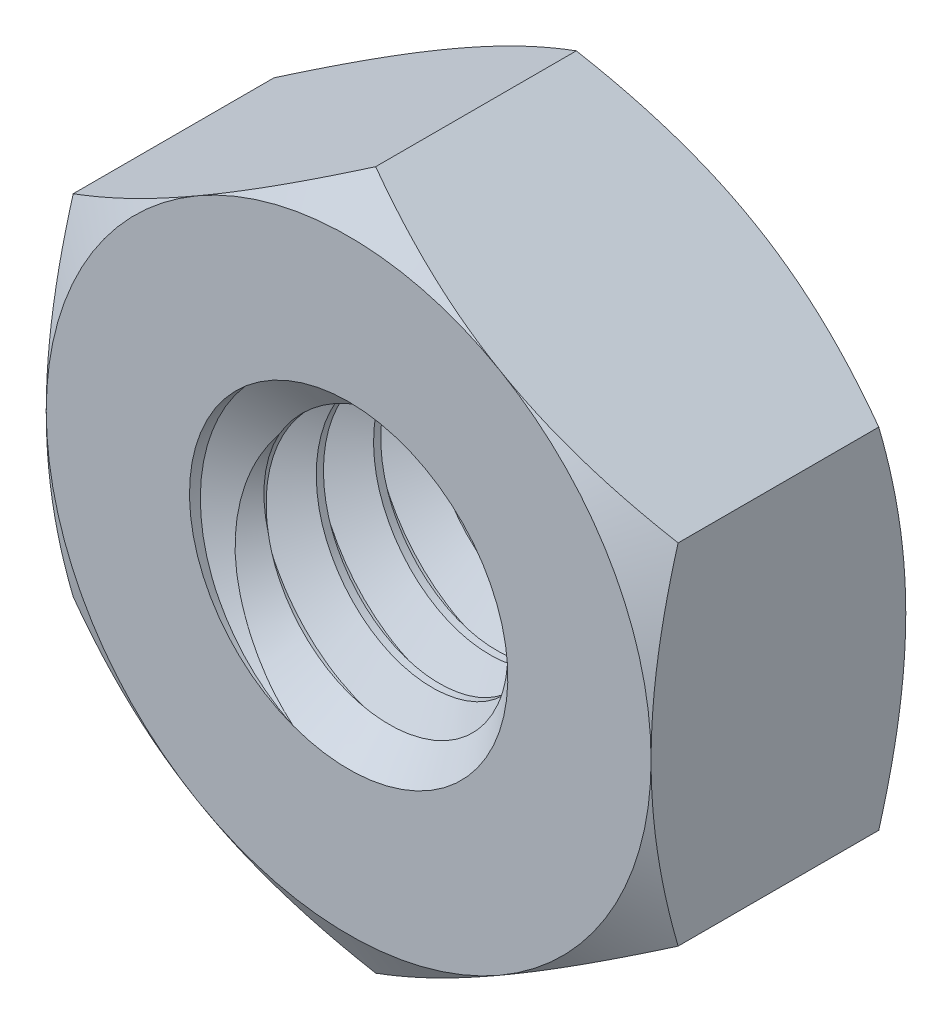
from build123d import *

# Parameters (mm, degrees)
EXTRUDE1_DEPTH          = 1
SKETCH13_R              = 1.25
BOSS_EXTRUDE1_DEPTH     = 2
CUT_SWEEP1_PITCH        = 0.45
SKETCH7_OUTSIDE_W       = 96.244
SKETCH7_OUTSIDE_H       = 96.978
SKETCH7_OUTSIDE_R       = 2.375
EXTRUDE2_DEPTH          = 25.4
EXTRUDE2_DRAFT          = -60
MIRROR2_COPY_1_SKETCH_W = 96.244
MIRROR2_COPY_1_SKETCH_H = 96.978
MIRROR2_COPY_1_SKETCH_R = 2.375
MIRROR2_COPY_1_DEPTH    = 25.4
MIRROR2_COPY_1_DRAFT    = -60


with BuildPart() as part:
    # Sketch1 → Extrude1 (new, symmetric)
    with BuildSketch(Plane.XY):
        Polygon((-2.375, 1.371206889), (-2.375, -1.371206889), (0, -2.742413779), (2.375, -1.371206889), (2.375, 1.371206889), (0, 2.742413779), align=None)
    extrude(amount=EXTRUDE1_DEPTH, both=True)

    # Cut-Extrude2 cone 1 section (through the dimple's axis) → Cut-Extrude2 (revolve, cut)
    with BuildSketch(Plane(origin=(0, 0, 1), x_dir=(0, -1, 0), z_dir=(1, 0, 0))):
        Polygon((0, 0), (1.25, 0), (0, 1.25), align=None)
    revolve(axis=Axis((0, 0, 1), (0, 0, -1)), mode=Mode.SUBTRACT)

    # Cut-Extrude3 cone 1 section (through the dimple's axis) → Cut-Extrude3 (revolve, cut)
    with BuildSketch(Plane(origin=(0, 0, -1), x_dir=(0, 1, 0), z_dir=(1, 0, 0))):
        Polygon((0, 0), (1.25, 0), (0, 1.25), align=None)
    revolve(axis=Axis((0, 0, -1), (0, 0, 1)), mode=Mode.SUBTRACT)


with BuildPart() as body_2:
    # Sketch13 → Boss-Extrude1 (new body)
    with BuildSketch(Plane(origin=(0, 0, -1), x_dir=(-1, 0, 0), z_dir=(0, 0, -1))):
        Circle(SKETCH13_R)
    extrude(amount=-BOSS_EXTRUDE1_DEPTH)

    # Cut-Sweep1: arcs per turn and ends read off the stored shape
    # Cut-Sweep1: the profile of Sketch12 profile screwed along a right-hand helix through 6 turns, 6 arcs to a turn; built about Z, then put on its axis
    cut_sweep1_z = Axis((0, 0, 0), (0, 0, 1))
    cut_sweep1_corners = [(1.2503, 0, -0.843923205), (1.2503, 0, -0.449826795), (0.957716426, 0, -0.61875), (0.957716426, 0, -0.675)]
    with BuildLine(mode=Mode.PRIVATE) as cut_sweep1_profile:
        Line(cut_sweep1_corners[0], cut_sweep1_corners[1])
        Line(cut_sweep1_corners[1], cut_sweep1_corners[2])
        Line(cut_sweep1_corners[2], cut_sweep1_corners[3])
        Line(cut_sweep1_corners[3], cut_sweep1_corners[0])
    cut_sweep1_cap = Face(cut_sweep1_profile.wire())
    cut_sweep1_turn_angles = [0, 30, 60, 90, 120, 150, 180, 210, 240, 270, 300, 330, 360]
    cut_sweep1_turn_weights = [1, 0.8660254037844387, 1, 0.8660254037844387, 1, 0.8660254037844387, 1, 0.8660254037844387, 1, 0.8660254037844387, 1, 0.8660254037844387, 1]
    cut_sweep1_turn_rails = [Edge.make_bspline([Vector(p[0], p[1], 0).rotate(cut_sweep1_z, cut_sweep1_turn_angles[k]) / cut_sweep1_turn_weights[k] + Vector(0, 0, p[2] + CUT_SWEEP1_PITCH * cut_sweep1_turn_angles[k] / 360) for k in range(13)], [0, 0, 0, 1, 1, 2, 2, 3, 3, 4, 4, 5, 5, 6, 6, 6], 2, cut_sweep1_turn_weights) for p in cut_sweep1_corners]
    cut_sweep1_turn_sides = [Face.make_surface_from_curves(cut_sweep1_turn_rails[p[0]], cut_sweep1_turn_rails[p[1]]) for p in [(0, 1), (1, 2), (2, 3), (3, 0)]]
    cut_sweep1 = Plane(origin=(0, 0, -1), x_dir=(0, 1, 0), z_dir=(0, 0, 1)) * Solid(Shell([*[p.moved(Location((0, 0, CUT_SWEEP1_PITCH * i))) for i in range(6) for p in cut_sweep1_turn_sides], cut_sweep1_cap, cut_sweep1_cap.rotate(cut_sweep1_z, 2160).moved(Location((0, 0, CUT_SWEEP1_PITCH * 2160 / 360)))]))
    add(cut_sweep1, mode=Mode.SUBTRACT)


with BuildPart() as part_1:
    add(part.part)

    # Combine1: cut body 2
    add(body_2.part, mode=Mode.SUBTRACT)


with BuildPart() as extrude2_tool:
    # Sketch7 outside → Extrude2 (with draft: the straight prism first)
    with BuildSketch(Plane.XY.offset(1)):
        Rectangle(SKETCH7_OUTSIDE_W, SKETCH7_OUTSIDE_H)
        Circle(SKETCH7_OUTSIDE_R, mode=Mode.SUBTRACT)
    extrude(amount=-EXTRUDE2_DEPTH)
    # Extrude2: the draft: its side faces are tilted about the plane it starts from
    extrude2_sides = [extrude2_tool.faces().sort_by_distance(p)[0] for p in [
        (0, -48.489, -11.7),
        (48.122, 0, -11.7),
        (0, 48.489, -11.7),
        (-48.122, 0, -11.7),
        (-2.375, 0, -11.7),
    ]]
    draft(extrude2_sides, Plane.XY.offset(1), EXTRUDE2_DRAFT)


with BuildPart() as part_2:
    add(part_1.part)

    # Extrude2: cut by extrude2_tool
    add(extrude2_tool.part, mode=Mode.SUBTRACT)


with BuildPart() as mirror2_copy_1_tool:
    # Mirror2 copy 1 sketch → Mirror2 copy 1 (with draft: the straight prism first)
    with BuildSketch(Plane(origin=(0, 0, -1), x_dir=(1, 0, 0), z_dir=(0, 0, -1))):
        Rectangle(MIRROR2_COPY_1_SKETCH_W, MIRROR2_COPY_1_SKETCH_H)
        Circle(MIRROR2_COPY_1_SKETCH_R, mode=Mode.SUBTRACT)
    extrude(amount=-MIRROR2_COPY_1_DEPTH)
    # Mirror2 copy 1: the draft: its side faces are tilted about the plane it starts from
    mirror2_copy_1_sides = [mirror2_copy_1_tool.faces().sort_by_distance(p)[0] for p in [
        (0, -48.489, 11.7),
        (48.122, 0, 11.7),
        (0, 48.489, 11.7),
        (-48.122, 0, 11.7),
        (-2.375, 0, 11.7),
    ]]
    draft(mirror2_copy_1_sides, Plane(origin=(0, 0, -1), x_dir=(1, 0, 0), z_dir=(0, 0, -1)), MIRROR2_COPY_1_DRAFT)


with BuildPart() as part_3:
    add(part_2.part)

    # Mirror2 copy 1: cut by mirror2_copy_1_tool
    add(mirror2_copy_1_tool.part, mode=Mode.SUBTRACT)


solid = part_3.part
